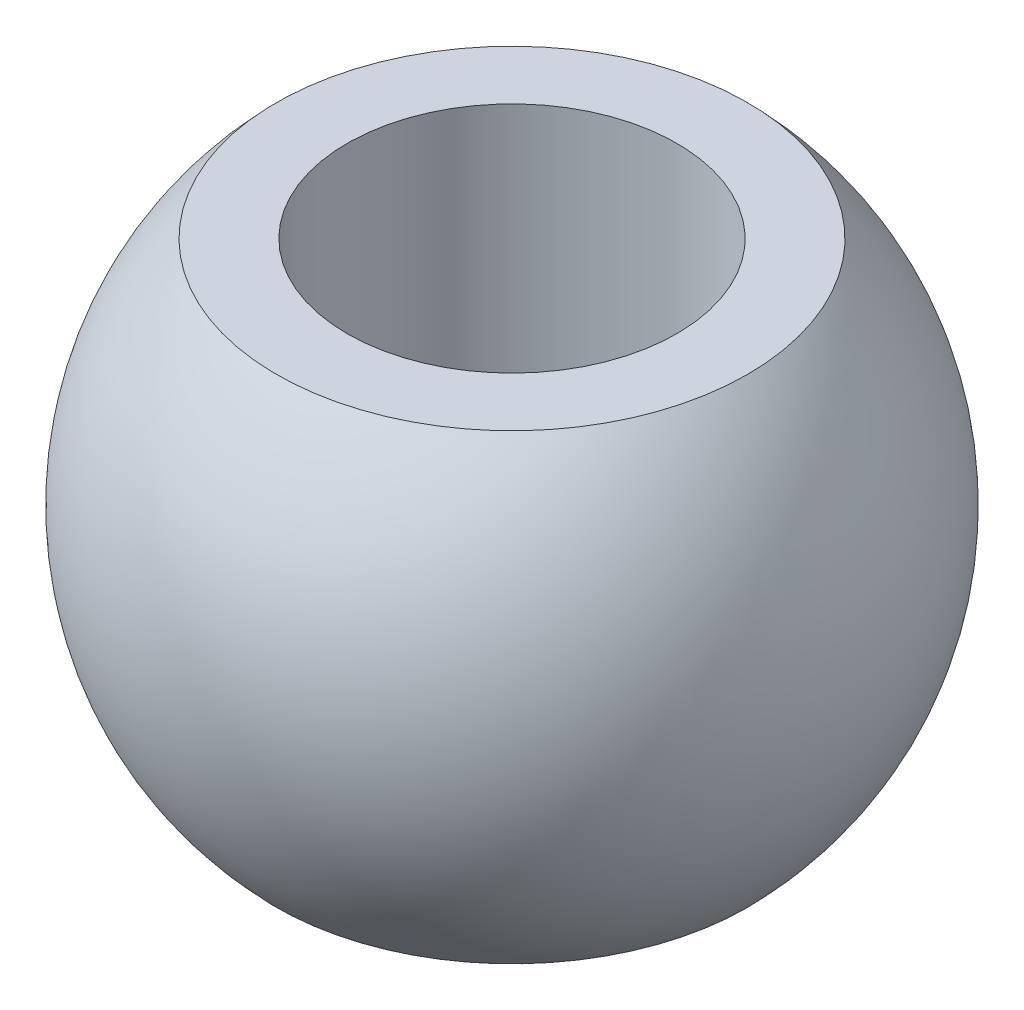
from build123d import *


with BuildPart() as part:
    # Sketch2 → Revolve1 (revolve)
    with BuildSketch(Plane.XY):
        with BuildLine():
            Line((5, -7), (5, 7))
            Line((5, 7), (7.141428429, 7))
            ThreePointArc((7.141428429, 7), (10, 0), (7.141428429, -7))
            Line((7.141428429, -7), (5, -7))
        make_face()
    revolve(axis=Axis((0, 29.836876516, 0), (0, -1, 0)))


solid = part.part
